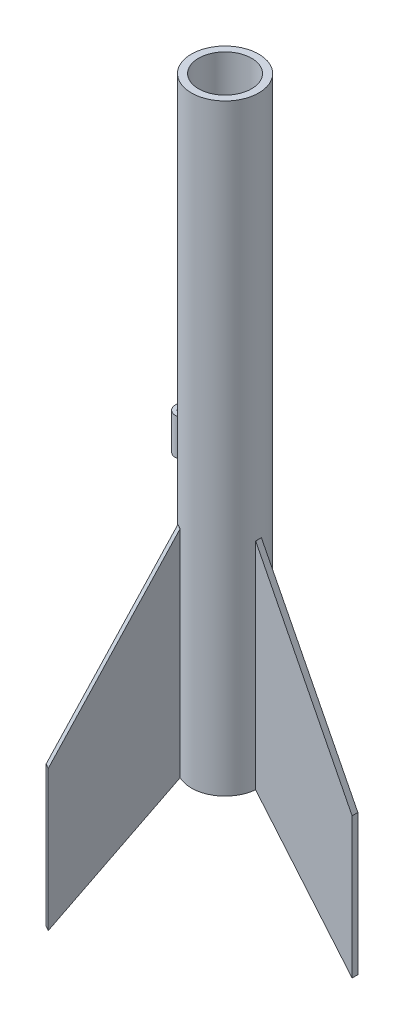
from build123d import *

# Parameters (mm, degrees)
SKETCH2_R                = 11.75
SKETCH2_R_2              = 9.25
BOSS_EXTRUDE1_DEPTH      = 210
SKETCH5_R                = 9.5
SKETCH5_R_2              = 4.625
BOSS_EXTRUDE2_DEPTH      = 12
BOSS_EXTRUDE3_DEPTH      = 1
CIRPATTERN1_COUNT        = 3
BOSS_EXTRUDE4_DEPTH      = 6.35
BOSS_EXTRUDE4_DEPTH_BACK = 6.35
SKETCH8_R                = 3.25
SKETCH8_R_2              = 1.9
SKETCH9_W                = 1
SKETCH9_H                = 16.330262046


with BuildPart() as part:
    # Sketch2 → Boss-Extrude1 (new body)
    with BuildSketch(Plane(origin=(-2.465768249, 0, -0.081027564), x_dir=(1, 0, 0), z_dir=(0, 1, 0))):
        with Locations((2.411661176, 0)):
            Circle(SKETCH2_R)
        with Locations((2.411661176, 0)):
            Circle(SKETCH2_R_2, mode=Mode.SUBTRACT)
    extrude(amount=BOSS_EXTRUDE1_DEPTH)

    # Sketch5 → Boss-Extrude2 (add)
    with BuildSketch(Plane(origin=(0, 60, 0), x_dir=(1, 0, 0), z_dir=(0, 1, 0))):
        with Locations((-0.054107074, 0.081027564)):
            Circle(SKETCH5_R)
        with Locations((-0.054107074, 0.081027564)):
            Circle(SKETCH5_R_2, mode=Mode.SUBTRACT)
    extrude(amount=BOSS_EXTRUDE2_DEPTH)

    # Sketch7 → Boss-Extrude3 (add, symmetric)
    with BuildSketch(Plane.XY):
        Polygon((11.695892926, 75.2), (9.828211369, 75.2), (10.695892926, 0), (11.695892926, 0), (45.34731611, -40), (45.34731611, 9), align=None)
    boss_extrude3 = extrude(amount=BOSS_EXTRUDE3_DEPTH, both=True)

    # CirPattern1: Boss-Extrude3 ×3 about axis
    cirpattern1_axis = Axis((-0.054107074, 210, -0.081027564), (0, -1, 0))
    for i in range(1, CIRPATTERN1_COUNT):
        add(boss_extrude3.rotate(cirpattern1_axis, i * 360 / CIRPATTERN1_COUNT))

    # Sketch8 → Boss-Extrude4 (add, two sides: drawn at the far end of the back side and taken through both)
    with BuildSketch(Plane(origin=(0.379836366, 95, 0), x_dir=(1, 0, 0), z_dir=(0, 1, 0)).offset(-BOSS_EXTRUDE4_DEPTH_BACK)):
        with Locations((-14.4, 0)):
            Circle(SKETCH8_R)
        with Locations((-14.4, 0)):
            Circle(SKETCH8_R_2, mode=Mode.SUBTRACT)
    extrude(amount=BOSS_EXTRUDE4_DEPTH + BOSS_EXTRUDE4_DEPTH_BACK)

    # Sketch9 → Revolve-Thin1 (revolve)
    with BuildSketch(Plane(origin=(0, 110, 0), x_dir=(1, 0, 0), z_dir=(0, 1, 0))):
        with Locations((-6.173250471, 0)):
            Rectangle(SKETCH9_W, SKETCH9_H)
    revolve(axis=Axis((-6.673250471, 110, -8.165131023), (0, 0, 1)))


solid = part.part
